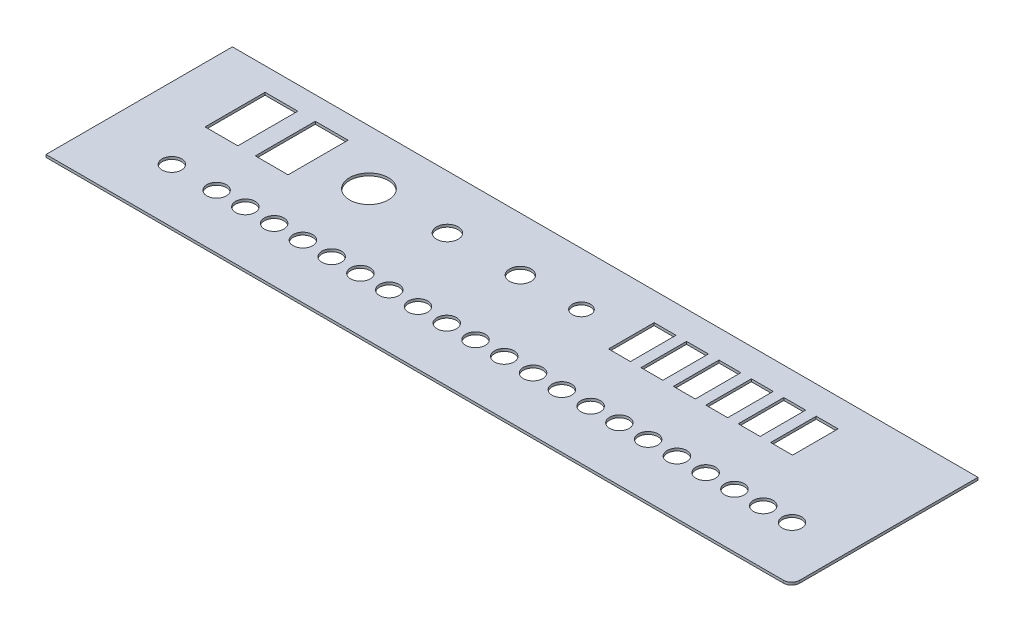
from build123d import *

# Parameters (mm, degrees)
SKETCH4_R           = 11.95
SKETCH4_R_2         = 6.65
SKETCH4_R_3         = 5.6
SKETCH4_R_4         = 6
SKETCH4_W           = 20.218579234
SKETCH4_H           = 37
SKETCH4_W_2         = 13.5
SKETCH4_H_2         = 28.1
BOSS_EXTRUDE1_DEPTH = 1.6


with BuildPart() as part:
    # Sketch4 → Boss-Extrude1 (new body)
    with BuildSketch(Plane(origin=(0, 0, 0), x_dir=(1, 0, 0), z_dir=(0, 1, 0))):
        with BuildLine():
            Line((-60.547420146, 63.390203379), (394.452579854, 63.390203379))
            Line((394.452579854, 63.390203379), (396.952579854, 63.390203379))
            Line((396.952579854, 63.390203379), (396.952579854, -46.609796621))
            ThreePointArc((396.952579854, -46.609796621), (395.48811376, -50.145330527), (391.952579854, -51.609796621))
            Line((391.952579854, -51.609796621), (-60.547420146, -51.609796621))
            Line((-60.547420146, -51.609796621), (-63.047420146, -51.609796621))
            Line((-63.047420146, -51.609796621), (-63.047420146, 63.390203379))
            Line((-63.047420146, 63.390203379), (-60.547420146, 63.390203379))
        make_face()
        with Locations((54.9, 29.690203379)):
            Circle(SKETCH4_R, mode=Mode.SUBTRACT)
        with Locations((102.75, 30.240203379)):
            Circle(SKETCH4_R_2, mode=Mode.SUBTRACT)
        with Locations((147.75, 30.240203379)):
            Circle(SKETCH4_R_2, mode=Mode.SUBTRACT)
        with Locations((184.9, 30.790203379)):
            Circle(SKETCH4_R_3, mode=Mode.SUBTRACT)
        with Locations((-18.9, -18.109796621)):
            Circle(SKETCH4_R_4, mode=Mode.SUBTRACT)
        with Locations((8.7, -18.109796621)):
            Circle(SKETCH4_R_4, mode=Mode.SUBTRACT)
        with Locations((26.45, -18.109796621)):
            Circle(SKETCH4_R_4, mode=Mode.SUBTRACT)
        with Locations((44.2, -18.109796621)):
            Circle(SKETCH4_R_4, mode=Mode.SUBTRACT)
        with Locations((61.95, -18.109796621)):
            Circle(SKETCH4_R_4, mode=Mode.SUBTRACT)
        with Locations((79.7, -18.109796621)):
            Circle(SKETCH4_R_4, mode=Mode.SUBTRACT)
        with Locations((97.45, -18.109796621)):
            Circle(SKETCH4_R_4, mode=Mode.SUBTRACT)
        with Locations((115.2, -18.109796621)):
            Circle(SKETCH4_R_4, mode=Mode.SUBTRACT)
        with Locations((132.95, -18.109796621)):
            Circle(SKETCH4_R_4, mode=Mode.SUBTRACT)
        with Locations((150.7, -18.109796621)):
            Circle(SKETCH4_R_4, mode=Mode.SUBTRACT)
        with Locations((168.45, -18.109796621)):
            Circle(SKETCH4_R_4, mode=Mode.SUBTRACT)
        with Locations((186.2, -18.109796621)):
            Circle(SKETCH4_R_4, mode=Mode.SUBTRACT)
        with Locations((203.95, -18.109796621)):
            Circle(SKETCH4_R_4, mode=Mode.SUBTRACT)
        with Locations((221.7, -18.109796621)):
            Circle(SKETCH4_R_4, mode=Mode.SUBTRACT)
        with Locations((239.45, -18.109796621)):
            Circle(SKETCH4_R_4, mode=Mode.SUBTRACT)
        with Locations((257.2, -18.109796621)):
            Circle(SKETCH4_R_4, mode=Mode.SUBTRACT)
        with Locations((274.95, -18.109796621)):
            Circle(SKETCH4_R_4, mode=Mode.SUBTRACT)
        with Locations((292.7, -18.109796621)):
            Circle(SKETCH4_R_4, mode=Mode.SUBTRACT)
        with Locations((310.45, -18.109796621)):
            Circle(SKETCH4_R_4, mode=Mode.SUBTRACT)
        with Locations((328.2, -18.109796621)):
            Circle(SKETCH4_R_4, mode=Mode.SUBTRACT)
        with Locations((345.95, -18.109796621)):
            Circle(SKETCH4_R_4, mode=Mode.SUBTRACT)
        with Locations((363.7, -18.109796621)):
            Circle(SKETCH4_R_4, mode=Mode.SUBTRACT)
        with Locations((-18.6, 30.690203379)):
            Rectangle(SKETCH4_W, SKETCH4_H, mode=Mode.SUBTRACT)
        with Locations((12.4, 30.690203379)):
            Rectangle(SKETCH4_W, SKETCH4_H, mode=Mode.SUBTRACT)
        with Locations((241.15, 32.073143277)):
            Rectangle(SKETCH4_W_2, SKETCH4_H_2, mode=Mode.SUBTRACT)
        with Locations((221.15, 32.073143277)):
            Rectangle(SKETCH4_W_2, SKETCH4_H_2, mode=Mode.SUBTRACT)
        with Locations((261.15, 32.073143277)):
            Rectangle(SKETCH4_W_2, SKETCH4_H_2, mode=Mode.SUBTRACT)
        with Locations((281.15, 32.073143277)):
            Rectangle(SKETCH4_W_2, SKETCH4_H_2, mode=Mode.SUBTRACT)
        with Locations((301.15, 32.073143277)):
            Rectangle(SKETCH4_W_2, SKETCH4_H_2, mode=Mode.SUBTRACT)
        with Locations((321.15, 32.073143277)):
            Rectangle(SKETCH4_W_2, SKETCH4_H_2, mode=Mode.SUBTRACT)
    extrude(amount=BOSS_EXTRUDE1_DEPTH)


solid = part.part
